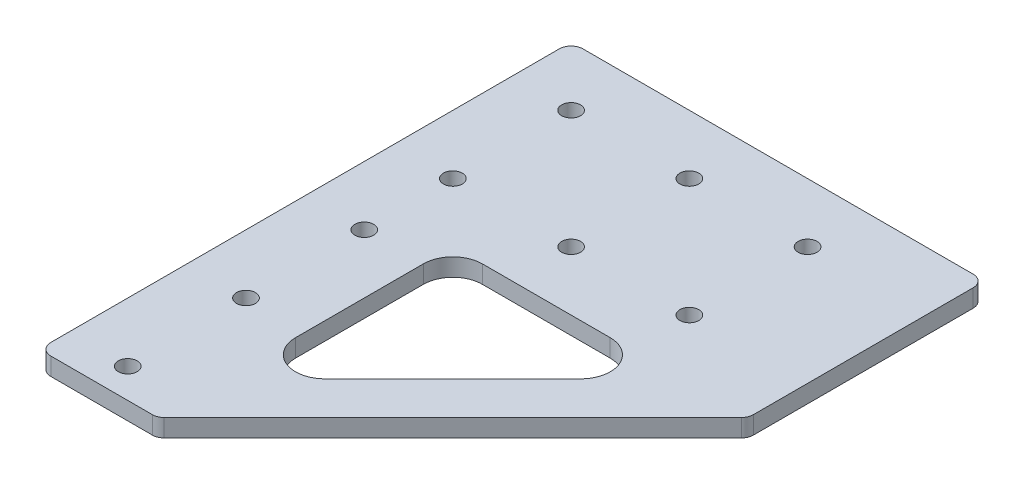
from build123d import *

# Parameters (mm, degrees)
SKETCH_1_R      = 1.6
EXTRUDE_1_DEPTH = 3
FILLET_1_R      = 2
FILLET_2_R      = 5


with BuildPart() as part:
    # 草图1 → 凸台-拉伸1 (new body)
    with BuildSketch(Plane(origin=(0, 0, 0), x_dir=(1, 0, 0), z_dir=(0, 1, 0))):
        Polygon((0, -50), (-20, -50), (-20, 40), (50, 40), (50, 0), align=None)
        with Locations((-10, -5)):
            Circle(SKETCH_1_R, mode=Mode.SUBTRACT)
        with Locations((-10, -25)):
            Circle(SKETCH_1_R, mode=Mode.SUBTRACT)
        with Locations((-10, -45)):
            Circle(SKETCH_1_R, mode=Mode.SUBTRACT)
        with Locations((-10, 10)):
            Circle(SKETCH_1_R, mode=Mode.SUBTRACT)
        with Locations((-10, 30)):
            Circle(SKETCH_1_R, mode=Mode.SUBTRACT)
        with Locations((10, 30)):
            Circle(SKETCH_1_R, mode=Mode.SUBTRACT)
        with Locations((10, 10)):
            Circle(SKETCH_1_R, mode=Mode.SUBTRACT)
        with Locations((30, 30)):
            Circle(SKETCH_1_R, mode=Mode.SUBTRACT)
        with Locations((30, 10)):
            Circle(SKETCH_1_R, mode=Mode.SUBTRACT)
        Polygon((0, -38.686291501), (0, 0), (38.686291501, 0), align=None, mode=Mode.SUBTRACT)
    extrude(amount=EXTRUDE_1_DEPTH)

    # 圆角1
    fillet_1_edges = [part.edges().sort_by_distance(p)[0] for p in [
        (-20, 1.5, 50),
        (-20, 1.5, -40),
        (50, 1.5, -40),
        (50, 1.5, 0),
        (0, 1.5, 50),
    ]]
    fillet(fillet_1_edges, radius=FILLET_1_R)

    # 圆角2
    fillet_2_edges = [part.edges().sort_by_distance(p)[0] for p in [
        (0, 1.5, 0),
        (0, 1.5, 38.686291501),
        (38.686291501, 1.5, 0),
    ]]
    fillet(fillet_2_edges, radius=FILLET_2_R)


solid = part.part
